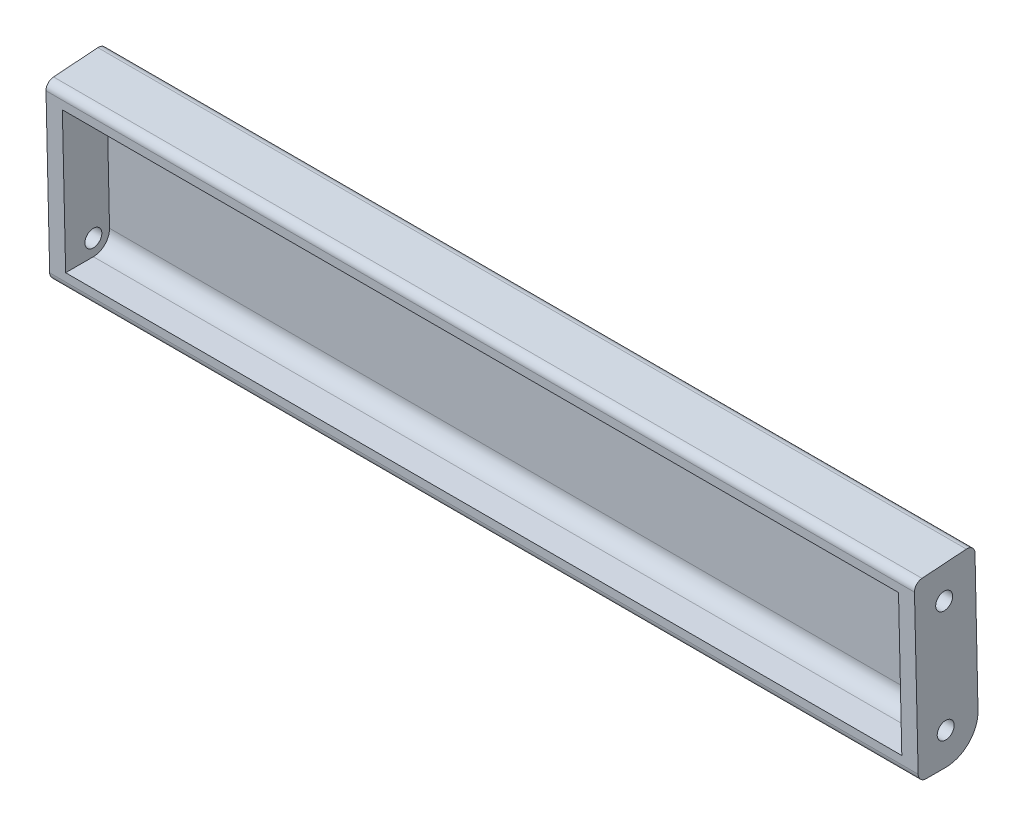
from build123d import *

# Parameters (mm, degrees)
BOSS_EXTRUDE1_DEPTH = 215
SHELL1_START        = 4
SHELL1_DEPTH        = 207
SKETCH3_R           = 2.1
CUT_EXTRUDE1_DEPTH  = 231.683632934
FILLET1_R           = 2


# Read off the part's stored shape, not the designer's step: Shell1
with BuildPart() as part:
    # Sketch1 → Boss-Extrude1 (new body)
    with BuildSketch(Plane(origin=(0, 0, 0), x_dir=(0, 0, -1), z_dir=(1, 0, 0))):
        with BuildLine():
            Line((70.261974321, -14.858488677), (65.445567386, -14.858488677))
            ThreePointArc((65.445567386, -14.858488677), (64.047743646, -14.288904278), (63.446098501, -12.904577468))
            Line((63.446098501, -12.904577468), (62.535908701, 26.582164322))
            ThreePointArc((62.535908701, 26.582164322), (63.05617043, 27.974338618), (64.393258315, 28.623197251))
            Line((64.393258315, 28.623197251), (75.379560776, 29.405858418))
            ThreePointArc((75.379560776, 29.405858418), (76.868805698, 28.889174231), (77.521211792, 27.454190163))
            Line((77.521211792, 27.454190163), (78.259876122, -6.675276303))
            ThreePointArc((78.259876122, -6.675276303), (75.98323725, -12.450192398), (70.261974321, -14.858488677))
        make_face()
    extrude(amount=BOSS_EXTRUDE1_DEPTH)

    # Shell1 outline → Shell1 (cut)
    with BuildSketch(Plane.YZ.offset(SHELL1_START)):
        with BuildLine():
            Line((-10.858488677, -63.398935097), (-10.858488677, -70.261974321))
            ThreePointArc((-10.858488677, -70.261974321), (-9.652532179, -73.124372077), (-6.761828222, -74.260806245))
            Line((-6.761828222, -74.260806245), (25.266638922, -73.567620252))
            Line((25.266638922, -73.567620252), (24.484187937, -62.584268141))
            Line((24.484187937, -62.584268141), (-10.858488677, -63.398935097))
        make_face()
    extrude(amount=SHELL1_DEPTH, mode=Mode.SUBTRACT)

    # Sketch3 → Cut-Extrude1 (cut, through all)
    with BuildSketch(Plane(origin=(215, 0, 0), x_dir=(0, 0, -1), z_dir=(1, 0, 0))):
        with Locations((70.261974321, -6.858488677)):
            Circle(SKETCH3_R)
        with Locations((69.886409545, 21.014527834)):
            Circle(SKETCH3_R)
    extrude(amount=-CUT_EXTRUDE1_DEPTH, mode=Mode.SUBTRACT)

    # Fillet1
    fillet1_edges = [part.edges().sort_by_distance(p)[0] for p in [
        (107.5, 25.266638922, -73.567620252),
    ]]
    fillet(fillet1_edges, radius=FILLET1_R)


solid = part.part
